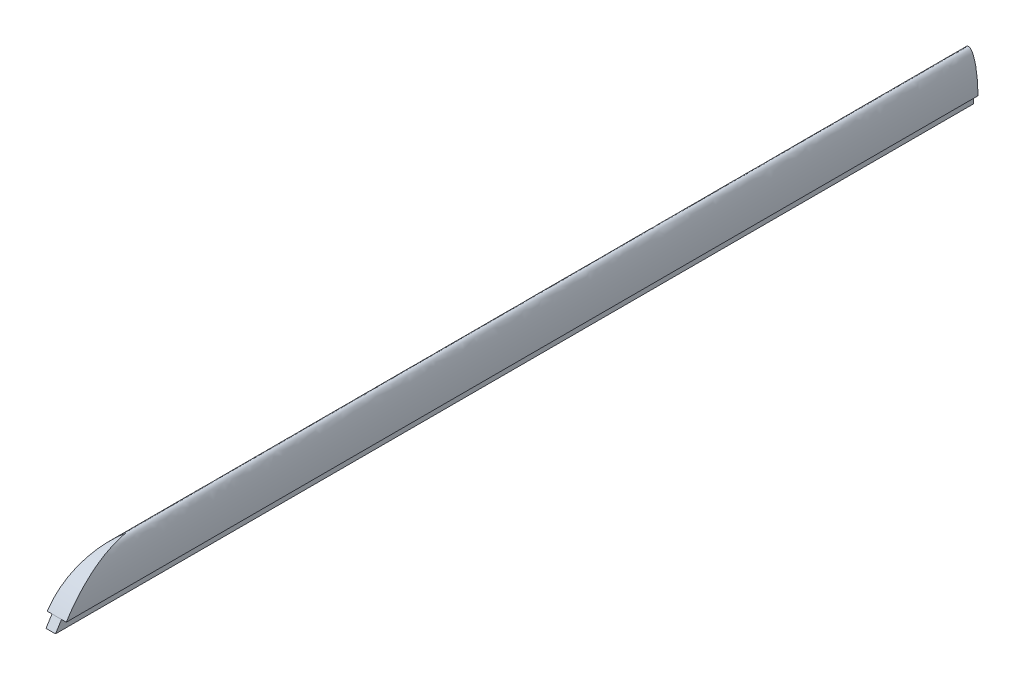
from build123d import *

# Parameters (mm, degrees)
PROFILE_EXTRUDE_DEPTH                = 2000
FLUSH_SUPPORT_CUT_REACH              = 2003.699
FLUSH_SUPPORT_CUT_DIRECTION_2_REACH  = 2003.699
SUPPORT_CORNER_CUT_REACH             = 1936.444
SUPPORT_CORNER_CUT_DIRECTION_2_REACH = 1936.444


with BuildPart() as part:
    # Cross Section → Profile Extrude (new body)
    with BuildSketch(Plane.XY):
        with BuildLine():
            Line((10, 0), (20, 0))
            add(Edge.make_bspline(
                [(20, 0), (20, 80), (0, 80), (-20, 80), (-20, 0)],
                knots=[1.570796327, 1.570796327, 1.570796327, 3.141592654, 3.141592654, 4.71238898, 4.71238898, 4.71238898], degree=2, weights=[1, 0.707106781, 1, 0.707106781, 1]))
            Line((-20, 0), (-10, 0))
            Line((-10, 0), (-10, -20))
            Line((-10, -20), (10, -20))
            Line((10, -20), (10, 0))
        make_face()
    extrude(amount=PROFILE_EXTRUDE_DEPTH)

    # Flush Support Cut Sketch → Flush Support Cut (cut, up to next)
    with BuildSketch(Plane(origin=(0, 0, 0), x_dir=(0, 0, -1), z_dir=(1, 0, 0)), mode=Mode.PRIVATE) as flush_support_cut_sk1:
        Polygon((-2000, -126.123848559), (-1869.256226534, 80), (-2000, 80), align=None)
    flush_support_cut_tool1 = extrude(flush_support_cut_sk1.sketch, amount=-FLUSH_SUPPORT_CUT_REACH, mode=Mode.PRIVATE) & part.part
    add(flush_support_cut_tool1.solids().sort_by_distance((0, 11.29205, 1956.418742))[0], mode=Mode.SUBTRACT)

    # Flush Support Cut Sketch → Flush Support Cut direction 2 (cut, up to next)
    with BuildSketch(Plane(origin=(0, 0, 0), x_dir=(0, 0, -1), z_dir=(1, 0, 0)), mode=Mode.PRIVATE) as flush_support_cut_direction_2_sk1:
        Polygon((-2000, -126.123848559), (-1869.256226534, 80), (-2000, 80), align=None)
    flush_support_cut_direction_2_tool1 = extrude(flush_support_cut_direction_2_sk1.sketch, amount=FLUSH_SUPPORT_CUT_DIRECTION_2_REACH, mode=Mode.PRIVATE) & part.part
    add(flush_support_cut_direction_2_tool1.solids().sort_by_distance((0, 11.29205, 1956.418742))[0], mode=Mode.SUBTRACT)

    # Support Corner Cut Sketch → Support Corner Cut (cut, up to next)
    with BuildSketch(Plane(origin=(0, 0, 0), x_dir=(0, 0, -1), z_dir=(1, 0, 0)), mode=Mode.PRIVATE) as support_corner_cut_sk1:
        with BuildLine():
            Line((-1774.520116493, 80), (-1869.256226534, 80))
            Line((-1869.256226534, 80), (-1920, 0))
            ThreePointArc((-1920, 0), (-1857.532760869, 58.68089476), (-1774.520116493, 80))
        make_face()
    support_corner_cut_tool1 = extrude(support_corner_cut_sk1.sketch, amount=-SUPPORT_CORNER_CUT_REACH, mode=Mode.PRIVATE) & part.part
    add(support_corner_cut_tool1.solids().sort_by_distance((0, 63.278413, 1860.060956))[0], mode=Mode.SUBTRACT)

    # Support Corner Cut Sketch → Support Corner Cut direction 2 (cut, up to next)
    with BuildSketch(Plane(origin=(0, 0, 0), x_dir=(0, 0, -1), z_dir=(1, 0, 0)), mode=Mode.PRIVATE) as support_corner_cut_direction_2_sk1:
        with BuildLine():
            Line((-1774.520116493, 80), (-1869.256226534, 80))
            Line((-1869.256226534, 80), (-1920, 0))
            ThreePointArc((-1920, 0), (-1857.532760869, 58.68089476), (-1774.520116493, 80))
        make_face()
    support_corner_cut_direction_2_tool1 = extrude(support_corner_cut_direction_2_sk1.sketch, amount=SUPPORT_CORNER_CUT_DIRECTION_2_REACH, mode=Mode.PRIVATE) & part.part
    add(support_corner_cut_direction_2_tool1.solids().sort_by_distance((0, 63.278413, 1860.060956))[0], mode=Mode.SUBTRACT)


solid = part.part
